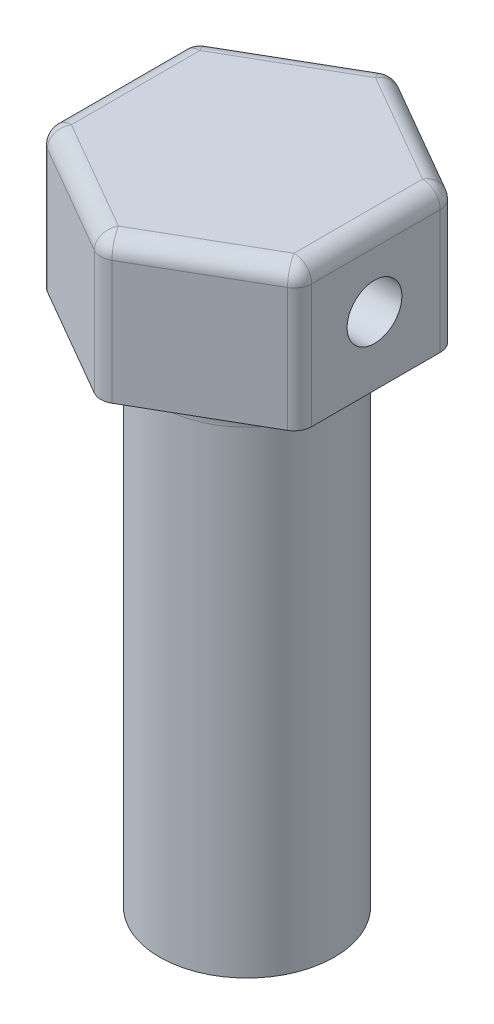
from build123d import *

# Parameters (mm, degrees)
BOSS_EXTRUDE1_DEPTH = 8
SKETCH2_R           = 4.95
BOSS_EXTRUDE2_DEPTH = 29
FILLET1_R           = 2
SKETCH3_R           = 1.55
CUT_EXTRUDE1_DEPTH  = 34.544199697
FILLET2_R           = 1
CUT_EXTRUDE3_START  = -2
SKETCH5_R           = 2.0875
CUT_EXTRUDE3_DEPTH  = 2


with BuildPart() as part:
    # Sketch1 → Boss-Extrude1 (new body)
    with BuildSketch(Plane(origin=(0, 0, 0), x_dir=(1, 0, 0), z_dir=(0, 1, 0))):
        Polygon((7.3, -4.214656965), (7.3, 4.214656965), (0, 8.42931393), (-7.3, 4.214656965), (-7.3, -4.214656965), (0, -8.42931393), align=None)
    extrude(amount=BOSS_EXTRUDE1_DEPTH)

    # Sketch2 → Boss-Extrude2 (add)
    with BuildSketch(Plane.XZ):
        Circle(SKETCH2_R)
        with BuildLine():
            Line((-1.5, 1.451776928), (-1.5, -1.451776928))
            ThreePointArc((-1.5, -1.451776928), (2.0875, 0), (-1.5, 1.451776928))
        make_face(mode=Mode.SUBTRACT)
    extrude(amount=BOSS_EXTRUDE2_DEPTH)

    # Fillet1
    fillet1_edges = [part.edges().sort_by_distance(p)[0] for p in [
        (-4.95, 0, 0),
    ]]
    fillet(fillet1_edges, radius=FILLET1_R)

    # Sketch3 → Cut-Extrude1 (cut, through all)
    with BuildSketch(Plane(origin=(7.3, 0, 0), x_dir=(0, 0, -1), z_dir=(1, 0, 0))):
        with Locations((-0.085343035, 3.85)):
            Circle(SKETCH3_R)
    extrude(amount=-CUT_EXTRUDE1_DEPTH, mode=Mode.SUBTRACT)

    # Fillet2
    fillet2_edges = [part.edges().sort_by_distance(p)[0] for p in [
        (-3.65, 8, 6.321985448),
        (-7.3, 8, 0),
        (-3.65, 8, -6.321985448),
        (3.65, 8, -6.321985448),
        (7.3, 8, 0),
        (3.65, 8, 6.321985448),
        (-7.3, 4, -4.214656965),
        (0, 4, -8.42931393),
        (7.3, 4, -4.214656965),
        (7.3, 4, 4.214656965),
        (0, 4, 8.42931393),
        (-7.3, 4, 4.214656965),
    ]]
    fillet(fillet2_edges, radius=FILLET2_R)

    # Sketch5 → Cut-Extrude3 (cut)
    with BuildSketch(Plane.XZ.offset(29).offset(CUT_EXTRUDE3_START)):
        Circle(SKETCH5_R)
    extrude(amount=CUT_EXTRUDE3_DEPTH, mode=Mode.SUBTRACT)


solid = part.part
